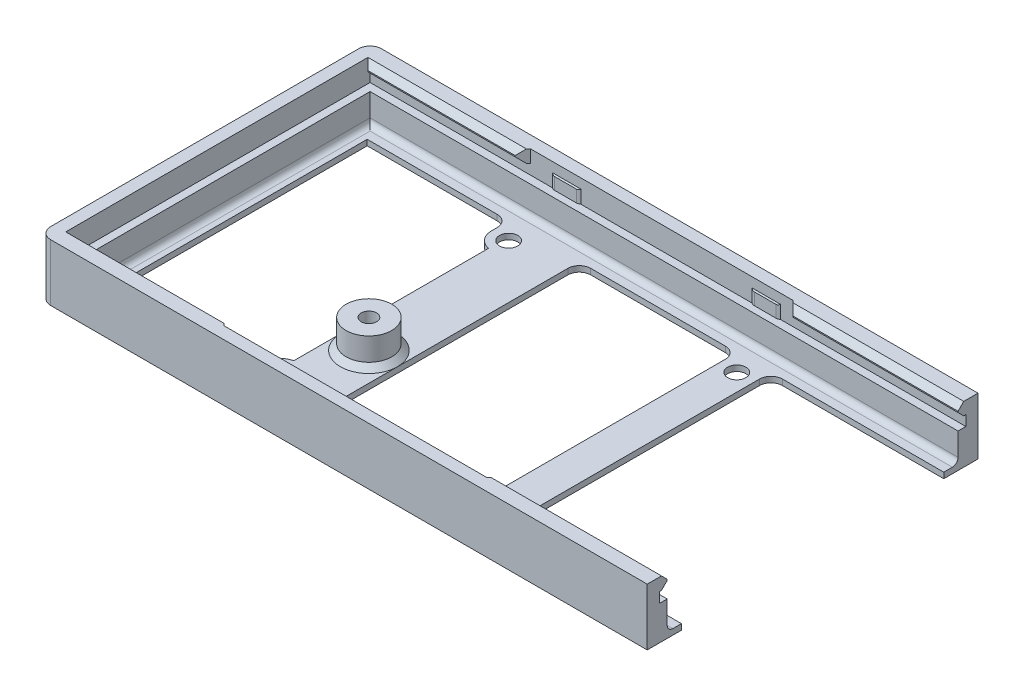
from build123d import *

# Parameters (mm, degrees)
CROQUIS1_W              = 106.6
CROQUIS1_H              = 58
CROQUIS1_R              = 1.6
SALIENTE_EXTRUIR1_DEPTH = 1
REDONDEO1_R             = 2
SALIENTE_EXTRUIR2_DEPTH = 9
CROQUIS3_W              = 53.74
CROQUIS3_H              = 1.8
CORTAR_EXTRUIR2_DEPTH   = 104.47
CROQUIS10_W             = 1.37
CROQUIS10_H             = 51
CORTAR_EXTRUIR4_DEPTH   = 4
CHAFL_N1_SIZE           = 1
CROQUIS5_W              = 0.2
CROQUIS5_H              = 1.8
SALIENTE_EXTRUIR4_DEPTH = 2.5
CROQUIS4_W              = 0.2
CROQUIS4_H              = 1.8
SALIENTE_EXTRUIR3_DEPTH = 2.5
REDONDEO5_R             = 2
CROQUIS6_W              = 10
CROQUIS6_H              = 46
CROQUIS6_R              = 1.35
CROQUIS6_W_2            = 6
SALIENTE_EXTRUIR5_DEPTH = 1
REDONDEO6_R             = 2
CROQUIS7_R              = 4
CROQUIS7_R_2            = 1.35
SALIENTE_EXTRUIR6_DEPTH = 5
CHAFL_N2_SIZE           = 1
REDONDEO4_R             = 1
CORTAR_EXTRUIR3_START   = -2.2
CROQUIS9_W              = 50
CROQUIS9_H              = 53.74
CORTAR_EXTRUIR3_DEPTH   = 2.2
CORTAR_EXTRUIR5_START   = -10
CROQUIS11_R             = 1.6
CROQUIS11_W             = 5.5
CROQUIS11_H             = 46
CORTAR_EXTRUIR5_DEPTH   = 10
REDONDEO7_R             = 1
CORTAR_EXTRUIR6_START   = -2.2
CROQUIS12_W             = 2
CROQUIS12_H             = 53
CORTAR_EXTRUIR6_DEPTH   = 2.2
CHAFL_N6_SIZE           = 2
CHAFL_N8_START          = 7.8
CHAFL_N8_DEPTH          = 0.5
CHAFL_N8_START_2        = -20
CHAFL_N8_2_DEPTH        = 42


with BuildPart() as part:
    # Croquis1 → Saliente-Extruir1 (new body)
    with BuildSketch(Plane(origin=(0, 0, 0), x_dir=(1, 0, 0), z_dir=(0, 1, 0))):
        Rectangle(CROQUIS1_W, CROQUIS1_H)
        with Locations(Location((-20, 20, 0), (0, 0, 270))):
            Circle(CROQUIS1_R, mode=Mode.SUBTRACT)
        with Locations(Location((20, 20, 0), (0, 0, 90))):
            Circle(CROQUIS1_R, mode=Mode.SUBTRACT)
        with Locations(Location((20, -20, 0), (0, 0, 270))):
            Circle(CROQUIS1_R, mode=Mode.SUBTRACT)
        with Locations(Location((-20, -20, 0), (0, 0, 90))):
            Circle(CROQUIS1_R, mode=Mode.SUBTRACT)
        with BuildLine():
            Line((-23, 20), (-23, 23))
            Line((-23, 23), (-47.8, 23))
            Line((-47.8, 23), (-47.8, -23))
            Line((-47.8, -23), (-23, -23))
            Line((-23, -23), (-23, -20))
            ThreePointArc((-23, -20), (-20, -17), (-17, -20))
            Line((-17, -20), (-17, -23))
            Line((-17, -23), (17, -23))
            Line((17, -23), (17, -20))
            ThreePointArc((17, -20), (20, -17), (23, -20))
            Line((23, -20), (23, -23))
            Line((23, -23), (47.8, -23))
            Line((47.8, -23), (47.8, 23))
            Line((47.8, 23), (23, 23))
            Line((23, 23), (23, 20))
            ThreePointArc((23, 20), (20, 17), (17, 20))
            Line((17, 20), (17, 23))
            Line((17, 23), (-17, 23))
            Line((-17, 23), (-17, 20))
            ThreePointArc((-17, 20), (-20, 17), (-23, 20))
        make_face(mode=Mode.SUBTRACT)
    extrude(amount=SALIENTE_EXTRUIR1_DEPTH)

    # Redondeo1
    redondeo1_edges = [part.edges().sort_by_distance(p)[0] for p in [
        (-23, 0.5, -23),
        (-23, 0.5, 23),
        (-17, 0.5, 23),
        (17, 0.5, 23),
        (23, 0.5, 23),
        (23, 0.5, -23),
        (17, 0.5, -23),
        (-17, 0.5, -23),
    ]]
    fillet(redondeo1_edges, radius=REDONDEO1_R)

    # Croquis2 → Saliente-Extruir2 (add)
    with BuildSketch(Plane(origin=(0, 1, 0), x_dir=(1, 0, 0), z_dir=(0, 1, 0))):
        Polygon((53.3, -25.5), (53.3, -29), (-53.3, -29), (-53.3, 29), (53.3, 29), (53.3, 25.5), (-49.8, 25.5), (-49.8, -25.5), align=None)
    extrude(amount=SALIENTE_EXTRUIR2_DEPTH)

    # Croquis3 → Cortar-Extruir2 (cut)
    with BuildSketch(Plane(origin=(53.3, 0, 0), x_dir=(0, 0, -1), z_dir=(1, 0, 0))):
        with Locations((0, 6.9)):
            Rectangle(CROQUIS3_W, CROQUIS3_H)
    extrude(amount=-CORTAR_EXTRUIR2_DEPTH, mode=Mode.SUBTRACT)

    # Croquis10 → Cortar-Extruir4 (cut)
    with BuildSketch(Plane(origin=(0, 10, 0), x_dir=(1, 0, 0), z_dir=(0, 1, 0))):
        with Locations((-50.485, 0)):
            Rectangle(CROQUIS10_W, CROQUIS10_H)
    extrude(amount=-CORTAR_EXTRUIR4_DEPTH, mode=Mode.SUBTRACT)

    # Chaflán1
    chafl_n1_edges = [part.edges().sort_by_distance(p)[0] for p in [
        (1.065, 10, 25.5),
        (1.065, 10, -25.5),
        (1.065, 7.8, -25.5),
        (1.065, 7.8, 25.5),
    ]]
    chamfer(chafl_n1_edges, length=CHAFL_N1_SIZE)

    # Croquis5 → Saliente-Extruir4 (add, symmetric)
    with BuildSketch(Plane(origin=(-16.7, 0, 0), x_dir=(0, 0, -1), z_dir=(1, 0, 0))):
        with Locations((26.77, 6.9)):
            Rectangle(CROQUIS5_W, CROQUIS5_H)
        with Locations((-26.77, 6.9)):
            Rectangle(CROQUIS5_W, CROQUIS5_H)
    extrude(amount=SALIENTE_EXTRUIR4_DEPTH, both=True)

    # Croquis4 → Saliente-Extruir3 (add, symmetric)
    with BuildSketch(Plane(origin=(18.3, 0, 0), x_dir=(0, 0, -1), z_dir=(1, 0, 0))):
        with Locations((-26.77, 6.9)):
            Rectangle(CROQUIS4_W, CROQUIS4_H)
        with Locations((26.77, 6.9)):
            Rectangle(CROQUIS4_W, CROQUIS4_H)
    extrude(amount=SALIENTE_EXTRUIR3_DEPTH, both=True)

    # Redondeo5
    redondeo5_edges = [part.edges().sort_by_distance(p)[0] for p in [
        (-53.3, 5, -29),
        (-53.3, 5, 29),
    ]]
    fillet(redondeo5_edges, radius=REDONDEO5_R)

    # Croquis6 → Saliente-Extruir5 (add)
    # profile 1 of 2: a face of its own
    with BuildSketch(Plane.XZ):
        with Locations((-15.61, 0)):
            Rectangle(CROQUIS6_W, CROQUIS6_H)
        with Locations(Location((-15.61, 8.89, 0), (0, 0, 270))):
            Circle(CROQUIS6_R, mode=Mode.SUBTRACT)
    # profile 2 of 2: a face of its own
    with BuildSketch(Plane.XZ):
        with Locations((20, 0)):
            Rectangle(CROQUIS6_W_2, CROQUIS6_H)
    extrude(amount=-SALIENTE_EXTRUIR5_DEPTH)

    # Redondeo6
    redondeo6_edges = [part.edges().sort_by_distance(p)[0] for p in [
        (-10.61, 0.5, -23),
        (-10.61, 0.5, 23),
    ]]
    fillet(redondeo6_edges, radius=REDONDEO6_R)

    # Croquis7 → Saliente-Extruir6 (add)
    with BuildSketch(Plane(origin=(0, 1, 0), x_dir=(1, 0, 0), z_dir=(0, 1, 0))):
        with Locations(Location((-15.61, -8.89, 0), (0, 0, 270))):
            Circle(CROQUIS7_R)
        with Locations(Location((-15.61, -8.89, 0), (0, 0, 90))):
            Circle(CROQUIS7_R_2, mode=Mode.SUBTRACT)
    extrude(amount=SALIENTE_EXTRUIR6_DEPTH)

    # Chaflán2
    chafl_n2_edges = [part.edges().sort_by_distance(p)[0] for p in [
        (-15.61, 1, 4.89),
    ]]
    chamfer(chafl_n2_edges, length=CHAFL_N2_SIZE - 0.0001)  # a hair under: the kernel refuses the full size

    # Redondeo4
    # the kernel refuses this fillet: 1 mm, written as the material it takes off along each edge
    with BuildSketch(Plane(origin=(15.8, 6, 26.67), x_dir=(0, 0, 1), z_dir=(0, 1, 0)), Plane(origin=(-19.2, 6, 26.67), x_dir=(0, 0, 1), z_dir=(0, 1, 0)), Plane(origin=(15.8, 7.8, -26.67), x_dir=(0, 0, -1), z_dir=(0, -1, 0))) as redondeo4_piece_1:
        with BuildLine():
            CenterArc((1, 0.6), REDONDEO4_R, 180, 36.869897646)
            Line((0, 0.6), (-0.02, 0.6))
            Line((-0.02, 0.6), (-0.02, 0))
            Line((-0.02, 0), (0, -0.02))
            ThreePointArc((0, -0.02), (0.1, -0.02), (0.184, -0.012))
            Line((0.184, -0.012), (0.2, 0))
        make_face()
    extrude(amount=1.8, mode=Mode.SUBTRACT)
    with BuildSketch(Plane(origin=(20.8, 6, 26.67), x_dir=(-1, 0, 0), z_dir=(0, 1, 0)), Plane(origin=(-14.2, 6, 26.67), x_dir=(-1, 0, 0), z_dir=(0, 1, 0)), Plane(origin=(20.8, 7.8, -26.67), x_dir=(-1, 0, 0), z_dir=(0, -1, 0))) as redondeo4_piece_2:
        with BuildLine():
            CenterArc((0.6, 1), REDONDEO4_R, 233.130102354, 36.869897646)
            Line((0, 0.2), (-0.012, 0.184))
            ThreePointArc((-0.012, 0.184), (-0.02, 0.1), (-0.02, 0))
            Line((-0.02, 0), (0, -0.02))
            Line((0, -0.02), (0.6, -0.02))
            Line((0.6, -0.02), (0.6, 0))
        make_face()
    extrude(amount=1.8, mode=Mode.SUBTRACT)
    with BuildSketch(Plane(origin=(-14.2, 6, -26.67), x_dir=(-1, 0, 0), z_dir=(0, 1, 0))) as redondeo4_piece_3:
        with BuildLine():
            CenterArc((0.6, -1), REDONDEO4_R, 90, 36.869897646)
            Line((0, -0.2), (-0.012, -0.184))
            ThreePointArc((-0.012, -0.184), (-0.02, -0.1), (-0.02, 0))
            Line((-0.02, 0), (0, 0.02))
            Line((0, 0.02), (0.6, 0.02))
            Line((0.6, 0.02), (0.6, 0))
        make_face()
    extrude(amount=1.8, mode=Mode.SUBTRACT)
    with BuildSketch(Plane(origin=(-19.2, 6, -26.67), x_dir=(0, 0, -1), z_dir=(0, 1, 0))) as redondeo4_piece_4:
        with BuildLine():
            CenterArc((1, -0.6), REDONDEO4_R, 143.130102354, 36.869897646)
            Line((0, -0.6), (-0.02, -0.6))
            Line((-0.02, -0.6), (-0.02, 0))
            Line((-0.02, 0), (0, 0.02))
            ThreePointArc((0, 0.02), (0.1, 0.02), (0.184, 0.012))
            Line((0.184, 0.012), (0.2, 0))
        make_face()
    extrude(amount=1.8, mode=Mode.SUBTRACT)

    # Croquis9 → Cortar-Extruir3 (cut)
    with BuildSketch(Plane(origin=(0, 10, 0), x_dir=(1, 0, 0), z_dir=(0, 1, 0)).offset(CORTAR_EXTRUIR3_START)):
        Rectangle(CROQUIS9_W, CROQUIS9_H)
    extrude(amount=CORTAR_EXTRUIR3_DEPTH, mode=Mode.SUBTRACT)

    # Croquis11 → Cortar-Extruir5 (cut)
    with BuildSketch(Plane(origin=(0, 1, 0), x_dir=(1, 0, 0), z_dir=(0, 1, 0)).offset(CORTAR_EXTRUIR5_START)):
        with Locations(Location((-20, 20, 0), (0, 0, 270))):
            Circle(CROQUIS11_R)
        with Locations(Location((20, -20, 0), (0, 0, 270))):
            Circle(CROQUIS11_R)
        with Locations(Location((20, 20, 0), (0, 0, 270))):
            Circle(CROQUIS11_R)
        with Locations(Location((-20, -20, 0), (0, 0, 90))):
            Circle(CROQUIS11_R)
        with Locations((50.55, 0)):
            Rectangle(CROQUIS11_W, CROQUIS11_H)
    extrude(amount=CORTAR_EXTRUIR5_DEPTH, mode=Mode.SUBTRACT)

    # Redondeo7
    redondeo7_edges = [part.edges().sort_by_distance(p)[0] for p in [
        (1.75, 1, 25.5),
        (-49.8, 1, 0),
        (1.75, 1, -25.5),
    ]]
    fillet(redondeo7_edges, radius=REDONDEO7_R)

    # Croquis12 → Cortar-Extruir6 (cut)
    with BuildSketch(Plane(origin=(0, 10, 0), x_dir=(1, 0, 0), z_dir=(0, 1, 0)).offset(CORTAR_EXTRUIR6_START)):
        with Locations((-50.17, 0)):
            Rectangle(CROQUIS12_W, CROQUIS12_H)
    extrude(amount=CORTAR_EXTRUIR6_DEPTH, mode=Mode.SUBTRACT)

    # Chaflán6
    # the kernel refuses this chamfer: 2 mm, written as the material it adds along each edge
    with BuildSketch(Plane(origin=(-49.17, 2.656634024, 26.5), x_dir=(-1, 0, 0), z_dir=(0, 1, 0))) as chafl_n6_piece_1_section:
        Polygon((CHAFL_N6_SIZE, 0), (0, -CHAFL_N6_SIZE), (0, 0), align=None)
    chafl_n6_piece_1 = extrude(amount=12.486731952, mode=Mode.PRIVATE)
    chafl_n6_piece_1 = split(chafl_n6_piece_1, bisect_by=Plane(origin=(-49.17, 2.656634024, 25.5), z_dir=(0, 0, 1)), keep=Keep.TOP, mode=Mode.PRIVATE)
    chafl_n6_piece_1 = split(chafl_n6_piece_1, bisect_by=Plane(origin=(-49.17, 6.328317012, 22.828317012), z_dir=(0, -0.7071067811865476, 0.7071067811865476)), keep=Keep.TOP, mode=Mode.PRIVATE)
    chafl_n6_piece_1 = split(chafl_n6_piece_1, bisect_by=Plane(origin=(-49.17, 5.228317012, 29.071682988), z_dir=(0, 0.7071067811865476, 0.7071067811865476)), keep=Keep.TOP, mode=Mode.PRIVATE)
    add(chafl_n6_piece_1)
    with BuildSketch(Plane(origin=(-49.17, 2.656634024, -26.5), x_dir=(-1, 0, 0), z_dir=(0, 1, 0))) as chafl_n6_piece_2_section:
        Polygon((CHAFL_N6_SIZE, 0), (0, CHAFL_N6_SIZE), (0, 0), align=None)
    chafl_n6_piece_2 = extrude(amount=12.486731952, mode=Mode.PRIVATE)
    chafl_n6_piece_2 = split(chafl_n6_piece_2, bisect_by=Plane(origin=(-49.17, 2.656634024, -25.5), z_dir=(0, 0, -1)), keep=Keep.TOP, mode=Mode.PRIVATE)
    chafl_n6_piece_2 = split(chafl_n6_piece_2, bisect_by=Plane(origin=(-49.17, 6.328317012, -22.828317012), z_dir=(0, -0.7071067811865476, -0.7071067811865476)), keep=Keep.TOP, mode=Mode.PRIVATE)
    chafl_n6_piece_2 = split(chafl_n6_piece_2, bisect_by=Plane(origin=(-49.17, 5.228317012, -29.071682988), z_dir=(0, 0.7071067811865471, -0.7071067811865479)), keep=Keep.TOP, mode=Mode.PRIVATE)
    add(chafl_n6_piece_2)
    with BuildSketch(Plane(origin=(25, 7.8, 26.87), x_dir=(-1, 0, 0), z_dir=(0, 1, 0))) as chafl_n6_piece_3_section:
        Polygon((CHAFL_N6_SIZE, 0), (0, -CHAFL_N6_SIZE), (0, 0), align=None)
    chafl_n6_piece_3 = extrude(amount=2.2, mode=Mode.PRIVATE)
    chafl_n6_piece_3 = split(chafl_n6_piece_3, bisect_by=Plane(origin=(25, 7.8, 25.5), z_dir=(0, 0, 1)), keep=Keep.TOP, mode=Mode.PRIVATE)
    chafl_n6_piece_3 = split(chafl_n6_piece_3, bisect_by=Plane(origin=(25, 7.615, 26.685), z_dir=(0, 0.7071067811865476, 0.7071067811865476)), keep=Keep.TOP, mode=Mode.PRIVATE)
    chafl_n6_piece_3 = split(chafl_n6_piece_3, bisect_by=Plane(origin=(25, 9.085, 25.585), z_dir=(0, -0.7071067811865476, 0.7071067811865476)), keep=Keep.TOP, mode=Mode.PRIVATE)
    add(chafl_n6_piece_3)
    with BuildSketch(Plane(origin=(-25, 7.8, 26.87), x_dir=(1, 0, 0), z_dir=(0, 1, 0))) as chafl_n6_piece_4_section:
        Polygon((CHAFL_N6_SIZE, 0), (0, CHAFL_N6_SIZE), (0, 0), align=None)
    chafl_n6_piece_4 = extrude(amount=2.2, mode=Mode.PRIVATE)
    chafl_n6_piece_4 = split(chafl_n6_piece_4, bisect_by=Plane(origin=(-25, 7.8, 25.5), z_dir=(0, 0, 1)), keep=Keep.TOP, mode=Mode.PRIVATE)
    chafl_n6_piece_4 = split(chafl_n6_piece_4, bisect_by=Plane(origin=(-25, 9.085, 25.585), z_dir=(0, -0.7071067811865476, 0.7071067811865476)), keep=Keep.TOP, mode=Mode.PRIVATE)
    chafl_n6_piece_4 = split(chafl_n6_piece_4, bisect_by=Plane(origin=(-25, 7.615, 26.685), z_dir=(0, 0.7071067811865476, 0.7071067811865476)), keep=Keep.TOP, mode=Mode.PRIVATE)
    add(chafl_n6_piece_4)
    with BuildSketch(Plane(origin=(25, 7.8, -26.87), x_dir=(-1, 0, 0), z_dir=(0, 1, 0))) as chafl_n6_piece_5_section:
        Polygon((CHAFL_N6_SIZE, 0), (0, CHAFL_N6_SIZE), (0, 0), align=None)
    chafl_n6_piece_5 = extrude(amount=2.2, mode=Mode.PRIVATE)
    chafl_n6_piece_5 = split(chafl_n6_piece_5, bisect_by=Plane(origin=(25, 7.8, -25.5), z_dir=(0, 0, -1)), keep=Keep.TOP, mode=Mode.PRIVATE)
    chafl_n6_piece_5 = split(chafl_n6_piece_5, bisect_by=Plane(origin=(25, 9.085, -25.585), z_dir=(0, -0.7071067811865476, -0.7071067811865476)), keep=Keep.TOP, mode=Mode.PRIVATE)
    chafl_n6_piece_5 = split(chafl_n6_piece_5, bisect_by=Plane(origin=(25, 7.615, -26.685), z_dir=(0, 0.7071067811865471, -0.7071067811865479)), keep=Keep.TOP, mode=Mode.PRIVATE)
    add(chafl_n6_piece_5)
    with BuildSketch(Plane(origin=(-25, 7.8, -26.87), x_dir=(1, 0, 0), z_dir=(0, 1, 0))) as chafl_n6_piece_6_section:
        Polygon((CHAFL_N6_SIZE, 0), (0, -CHAFL_N6_SIZE), (0, 0), align=None)
    chafl_n6_piece_6 = extrude(amount=2.2, mode=Mode.PRIVATE)
    chafl_n6_piece_6 = split(chafl_n6_piece_6, bisect_by=Plane(origin=(-25, 7.8, -25.5), z_dir=(0, 0, -1)), keep=Keep.TOP, mode=Mode.PRIVATE)
    chafl_n6_piece_6 = split(chafl_n6_piece_6, bisect_by=Plane(origin=(-25, 9.085, -25.585), z_dir=(0, -0.7071067811865476, -0.7071067811865476)), keep=Keep.TOP, mode=Mode.PRIVATE)
    chafl_n6_piece_6 = split(chafl_n6_piece_6, bisect_by=Plane(origin=(-25, 7.615, -26.685), z_dir=(0, 0.7071067811865471, -0.7071067811865479)), keep=Keep.TOP, mode=Mode.PRIVATE)
    add(chafl_n6_piece_6)

    # Chaflán8: read off the stored shape, not the designer's step
    # Chaflán8 outline → Chaflán8 (add)
    with BuildSketch(Plane(origin=(0, 0, 0), x_dir=(1, 0, 0), z_dir=(0, 1, 0)).offset(CHAFL_N8_START)):
        with BuildLine():
            ThreePointArc((16.4, -26.67), (16.083772234, -26.721316702), (15.8, -26.87))
            Line((15.8, -26.87), (20.8, -26.87))
            ThreePointArc((20.8, -26.87), (20.516227766, -26.721316702), (20.2, -26.67))
            Line((20.2, -26.67), (16.4, -26.67))
        make_face()
        with BuildLine():
            Line((-14.8, -26.67), (-18.6, -26.67))
            ThreePointArc((-18.6, -26.67), (-18.916227766, -26.721316702), (-19.2, -26.87))
            Line((-19.2, -26.87), (-14.2, -26.87))
            ThreePointArc((-14.2, -26.87), (-14.483772234, -26.721316702), (-14.8, -26.67))
        make_face()
        with BuildLine():
            Line((20.8, 26.87), (15.8, 26.87))
            ThreePointArc((15.8, 26.87), (16.083772234, 26.721316702), (16.4, 26.67))
            Line((16.4, 26.67), (20.2, 26.67))
            ThreePointArc((20.2, 26.67), (20.516227766, 26.721316702), (20.8, 26.87))
        make_face()
        with BuildLine():
            Line((-18.6, 26.67), (-14.8, 26.67))
            ThreePointArc((-14.8, 26.67), (-14.483772234, 26.721316702), (-14.2, 26.87))
            Line((-14.2, 26.87), (-19.2, 26.87))
            ThreePointArc((-19.2, 26.87), (-18.916227766, 26.721316702), (-18.6, 26.67))
        make_face()
    extrude(amount=CHAFL_N8_DEPTH)

    # Chafl_n8 2 outline → Chafl_n8 2 (cut)
    with BuildSketch(Plane.YZ.offset(CHAFL_N8_START_2)):
        Polygon((8.1, -26.67), (8.3, -26.87), (8.3, -26.67), align=None)
        Polygon((8.3, 26.87), (8.1, 26.67), (8.3, 26.67), align=None)
    extrude(amount=CHAFL_N8_2_DEPTH, mode=Mode.SUBTRACT)


solid = part.part
